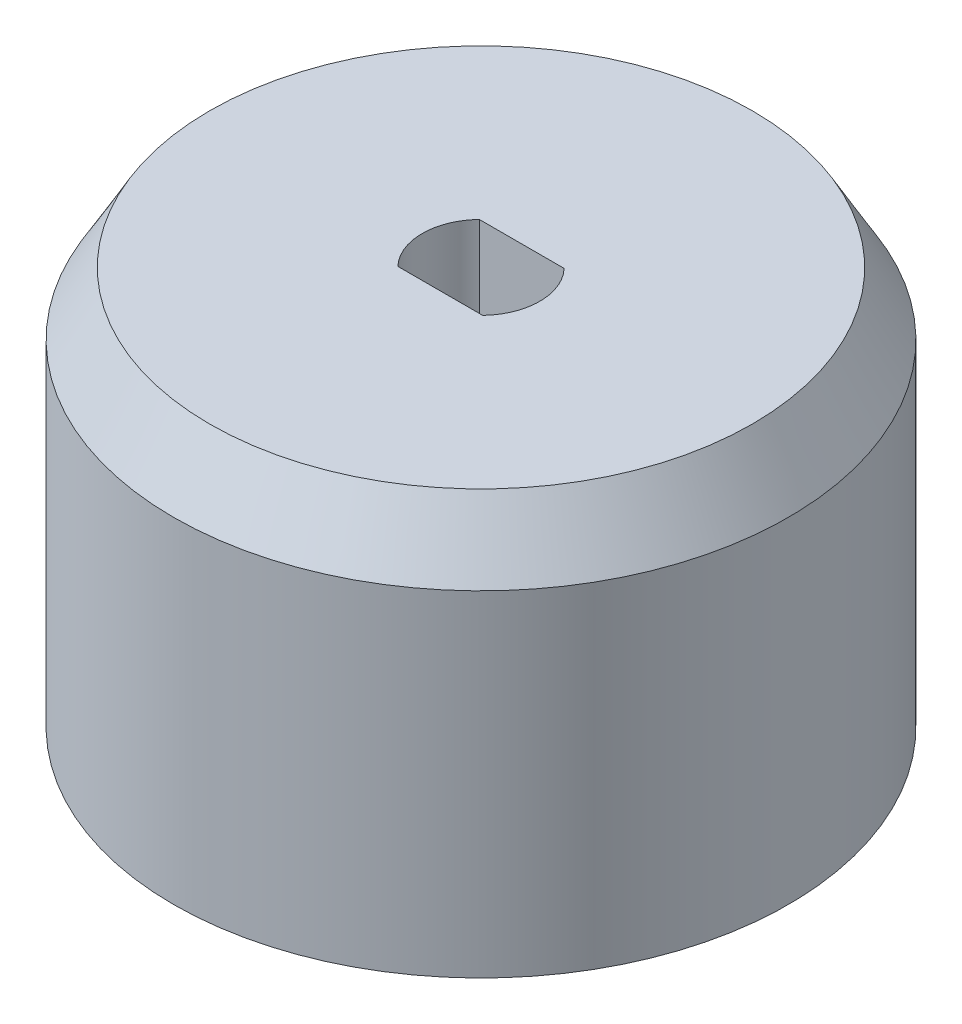
from build123d import *

# Parameters (mm, degrees)
SKETCH1_R                 = 17
SKETCH1_R_2               = 1.6000000000000005
SKETCH1_R_3               = 1.6000000000000019
SKETCH1_R_4               = 1.5999999999999999
BOSS_EXTRUDE1_DEPTH       = 6.500000000000001
SKETCH2_R                 = 17
SKETCH2_R_2               = 3.4999999999999996
SKETCH2_R_3               = 1.6000000000000012
SKETCH2_R_4               = 1.6000000000000019
SKETCH2_R_5               = 1.5999999999999963
BOSS_EXTRUDE2_DEPTH       = 2
SKETCH3_R                 = 17
SKETCH3_R_2               = 1.2
BOSS_EXTRUDE3_DEPTH       = 2
SKETCH9_R                 = 17
SKETCH9_R_2               = 1.2
SKETCH9_R_3               = 1.5999999999999963
SKETCH9_R_4               = 1.6000000000000012
SKETCH9_R_5               = 1.6000000000000019
BOSS_EXTRUDE6_DEPTH       = 2
BOSS_EXTRUDE4_OUTLINE_R   = 17
BOSS_EXTRUDE4_OUTLINE_R_2 = 1.6
BOSS_EXTRUDE4_DEPTH       = 5
SKETCH10_R                = 17
BOSS_EXTRUDE7_DEPTH       = 4.500000000000001
CHAMFER1_SIZE             = 1.154700538
CHAMFER1_SIZE_2           = 2


# Read off the part's stored shape, not the designer's step: Boss-Extrude4
with BuildPart() as part:
    # Sketch1 → Boss-Extrude1 (new body)
    with BuildSketch(Plane(origin=(0, 0, 0), x_dir=(1, 0, 0), z_dir=(0, 1, 0))):
        with Locations(Location((0, 0, 0), (0, 0, 270))):
            Circle(SKETCH1_R)
        with Locations(Location((0, 12, 0), (0, 0, 270))):
            Circle(SKETCH1_R_2, mode=Mode.SUBTRACT)
        with Locations(Location((10.392304845413268, -5.999999999999997, 0), (0, 0, 270))):
            Circle(SKETCH1_R_3, mode=Mode.SUBTRACT)
        with Locations(Location((-10.39230484541326, -6.000000000000005, 0), (0, 0, 270))):
            Circle(SKETCH1_R_4, mode=Mode.SUBTRACT)
        Polygon((4.04145188432738, -6.999999999999999), (8.082903768654761, -8.7e-16), (4.041451884327381, 6.999999999999999), (-4.041451884327381, 6.999999999999999), (-8.082903768654761, -8.7e-16), (-4.04145188432738, -6.999999999999999), align=None, mode=Mode.SUBTRACT)
    extrude(amount=BOSS_EXTRUDE1_DEPTH)

    # Sketch2 → Boss-Extrude2 (add)
    with BuildSketch(Plane(origin=(0, 6.500000000000001, 0), x_dir=(1, 0, 0), z_dir=(0, 1, 0))):
        with Locations(Location((0, 0, 0), (0, 0, 270))):
            Circle(SKETCH2_R)
        with Locations(Location((0, 0, 0), (0, 0, 270))):
            Circle(SKETCH2_R_2, mode=Mode.SUBTRACT)
        with Locations(Location((0, 12, 0), (0, 0, 270))):
            Circle(SKETCH2_R_3, mode=Mode.SUBTRACT)
        with Locations(Location((10.392304845413268, -5.999999999999997, 0), (0, 0, 270))):
            Circle(SKETCH2_R_4, mode=Mode.SUBTRACT)
        with Locations(Location((-10.39230484541326, -6.000000000000005, 0), (0, 0, 270))):
            Circle(SKETCH2_R_5, mode=Mode.SUBTRACT)
    extrude(amount=BOSS_EXTRUDE2_DEPTH)

    # Sketch3 → Boss-Extrude3 (add)
    with BuildSketch(Plane(origin=(0, 8.5, 0), x_dir=(1, 0, 0), z_dir=(0, 1, 0))):
        with Locations(Location((0, 0, 0), (0, 0, 270))):
            Circle(SKETCH3_R)
        with Locations(Location((0, 0, 0), (0, 0, 270))):
            Circle(SKETCH3_R_2, mode=Mode.SUBTRACT)
        Polygon((3.175426480542944, 11.999999999999996), (1.5877132402714735, 14.75), (-1.5877132402714682, 14.75), (-3.1754264805429417, 11.999999999999995), (-1.5877132402714735, 9.249999999999998), (1.5877132402714729, 9.249999999999998), align=None, mode=Mode.SUBTRACT)
        Polygon((-8.804591605141788, -8.750000000000009), (-7.216878364870316, -6.0000000000000036), (-8.80459160514179, -3.2500000000000013), (-11.980018085684733, -3.250000000000002), (-13.567731325956206, -6.000000000000007), (-11.980018085684732, -8.750000000000009), align=None, mode=Mode.SUBTRACT)
        Polygon((8.804591605141793, -8.75), (11.980018085684742, -8.75), (13.567731325956213, -5.999999999999997), (11.98001808568474, -3.2499999999999925), (8.804591605141791, -3.249999999999992), (7.216878364870319, -5.999999999999996), align=None, mode=Mode.SUBTRACT)
    extrude(amount=BOSS_EXTRUDE3_DEPTH)

    # Sketch9 → Boss-Extrude6 (add)
    with BuildSketch(Plane(origin=(0, 10.5, 0), x_dir=(1, 0, 0), z_dir=(0, 1, 0))):
        with Locations(Location((0, 0, 0), (0, 0, 270))):
            Circle(SKETCH9_R)
        with Locations(Location((0, 0, 0), (0, 0, 270))):
            Circle(SKETCH9_R_2, mode=Mode.SUBTRACT)
        with Locations(Location((-10.39230484541326, -6.000000000000005, 0), (0, 0, 270))):
            Circle(SKETCH9_R_3, mode=Mode.SUBTRACT)
        with Locations(Location((0, 12, 0), (0, 0, 270))):
            Circle(SKETCH9_R_4, mode=Mode.SUBTRACT)
        with Locations(Location((10.392304845413268, -5.999999999999997, 0), (0, 0, 270))):
            Circle(SKETCH9_R_5, mode=Mode.SUBTRACT)
    extrude(amount=BOSS_EXTRUDE6_DEPTH)

    # Boss-Extrude4 outline → Boss-Extrude4 (add)
    with BuildSketch(Plane(origin=(0, 12.5, 0), x_dir=(1, 0, 0), z_dir=(0, 1, 0))):
        Circle(BOSS_EXTRUDE4_OUTLINE_R)
        with Locations((-10.392304845, -6)):
            Circle(BOSS_EXTRUDE4_OUTLINE_R_2, mode=Mode.SUBTRACT)
        with Locations((10.392304845, -6)):
            Circle(BOSS_EXTRUDE4_OUTLINE_R_2, mode=Mode.SUBTRACT)
        with BuildLine():
            Line((-2.34520788, 2.25), (2.34520788, 2.25))
            ThreePointArc((2.34520788, 2.25), (3.25, 0), (2.34520788, -2.25))
            Line((2.34520788, -2.25), (-2.34520788, -2.25))
            ThreePointArc((-2.34520788, -2.25), (-3.25, 0), (-2.34520788, 2.25))
        make_face(mode=Mode.SUBTRACT)
        with Locations((0, 12)):
            Circle(BOSS_EXTRUDE4_OUTLINE_R_2, mode=Mode.SUBTRACT)
    extrude(amount=BOSS_EXTRUDE4_DEPTH)

    # Sketch10 → Boss-Extrude7 (add)
    with BuildSketch(Plane(origin=(0, 17.5, 0), x_dir=(1, 0, 0), z_dir=(0, 1, 0))):
        with Locations(Location((0, 0, 0), (0, 0, 270))):
            Circle(SKETCH10_R)
        with BuildLine():
            Line((-2.345207879911715, -2.2500000000000004), (2.345207879911715, -2.2500000000000004))
            ThreePointArc((2.345207879911715, -2.2500000000000004), (3.2500000000000004, 0), (2.345207879911715, 2.2500000000000004))
            Line((2.345207879911715, 2.2500000000000004), (-2.345207879911715, 2.2500000000000004))
            ThreePointArc((-2.345207879911715, 2.2500000000000004), (-3.2500000000000004, 4e-16), (-2.345207879911715, -2.2500000000000004))
        make_face(mode=Mode.SUBTRACT)
    extrude(amount=BOSS_EXTRUDE7_DEPTH)

    # Sketch5 → Cut-Revolve2 (revolve, cut)
    with BuildSketch(Plane(origin=(0, 0, 0), x_dir=(0, 0, -1), z_dir=(1, 0, 0)), mode=Mode.PRIVATE) as cut_revolve2_sk:
        Polygon((-17, 18.535898384862204), (-15.000000000000002, 22), (-17, 22.000000000000004), align=None)
    revolve(cut_revolve2_sk.sketch.rotate(Axis((0, 0, 0), (0, 1, 0)), 180), axis=Axis((0, 0, 0), (0, 1, 0)), mode=Mode.SUBTRACT)

    # Chamfer1
    # the kernel refuses this chamfer: 2, 1.154700538 mm, written as the material it adds along each edge
    with BuildSketch(Plane(origin=(-2.2883428e-10, 12.5, 0), x_dir=(-0.7079171545098687, 0, -0.706295478076032), z_dir=(-0.706295478076032, 0, 0.7079171545098687))) as chamfer1_piece_1:
        Polygon((3.2500000002288263 - CHAMFER1_SIZE, 0), (3.2500000002288343, -CHAMFER1_SIZE_2), (3.2500000002288263, 0), align=None)
    revolve(axis=Axis((-2.2883428e-10, 12.5, 0), (0, -1, 0)), revolution_arc=270.1314019865591)
    with BuildSketch(Plane(origin=(-7.519379389291984, 12.5, -2.2500000000000004), x_dir=(0, 0.9998132206222079, -0.01932676561270072), z_dir=(1, 0, 0))) as chamfer1_piece_2_section:
        Polygon((CHAMFER1_SIZE_2 * 0.999813220622, CHAMFER1_SIZE_2 * 0.0193267656127), (-CHAMFER1_SIZE * 0.019326765619, CHAMFER1_SIZE * 0.999813220951), (0, 0), align=None)
    chamfer1_piece_2 = extrude(amount=15.038758778583968, mode=Mode.PRIVATE)
    chamfer1_piece_2 = chamfer1_piece_2 - Plane(origin=(0, 13.182227685151497, 0), x_dir=(-1.8e-16, 0, 1), z_dir=(0, -1, 0)) * Cylinder(1.2, 39, mode=Mode.PRIVATE)
    add(chamfer1_piece_2)
    with BuildSketch(Plane(origin=(2.2883428e-10, 12.5, 0), x_dir=(0.7079171545098687, 0, 0.706295478076032), z_dir=(0.706295478076032, 0, -0.7079171545098687))) as chamfer1_piece_3:
        Polygon((3.2500000002288343, -CHAMFER1_SIZE_2), (3.250000000228834 - CHAMFER1_SIZE, 0), (3.250000000228834, 0), align=None)
    revolve(axis=Axis((2.2883428e-10, 12.5, 0), (0, -1, 0)), revolution_arc=270.1314019865591)
    with BuildSketch(Plane(origin=(7.519379389291984, 12.5, 2.2500000000000004), x_dir=(0, 0.9998132206222079, 0.01932676561270072), z_dir=(-1, 0, 0))) as chamfer1_piece_4_section:
        Polygon((CHAMFER1_SIZE_2 * 0.999813220622, CHAMFER1_SIZE_2 * 0.0193267656127), (-CHAMFER1_SIZE * 0.019326765619, CHAMFER1_SIZE * 0.999813220951), (0, 0), align=None)
    chamfer1_piece_4 = extrude(amount=15.038758778583968, mode=Mode.PRIVATE)
    chamfer1_piece_4 = chamfer1_piece_4 - Plane(origin=(0, 13.182227685146668, 0), x_dir=(-1.8e-16, 0, 1), z_dir=(0, -1, 0)) * Cylinder(1.2, 39, mode=Mode.PRIVATE)
    add(chamfer1_piece_4)


solid = part.part
